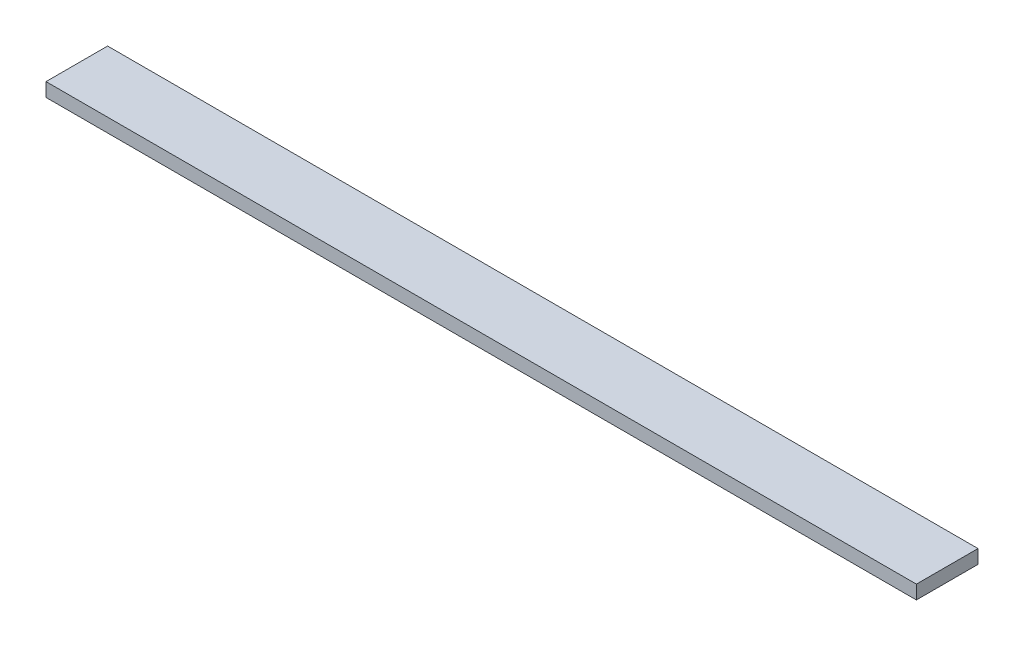
from build123d import *

# Parameters (mm, degrees)
SKETCH1_W           = 805
SKETCH1_H           = 56.98
BOSS_EXTRUDE1_DEPTH = 12.7


with BuildPart() as part:
    # Sketch1 → Boss-Extrude1 (new body)
    with BuildSketch(Plane(origin=(0, 0, 0), x_dir=(1, 0, 0), z_dir=(0, 1, 0))):
        with Locations((402.5, 28.49)):
            Rectangle(SKETCH1_W, SKETCH1_H)
    extrude(amount=BOSS_EXTRUDE1_DEPTH)


solid = part.part
